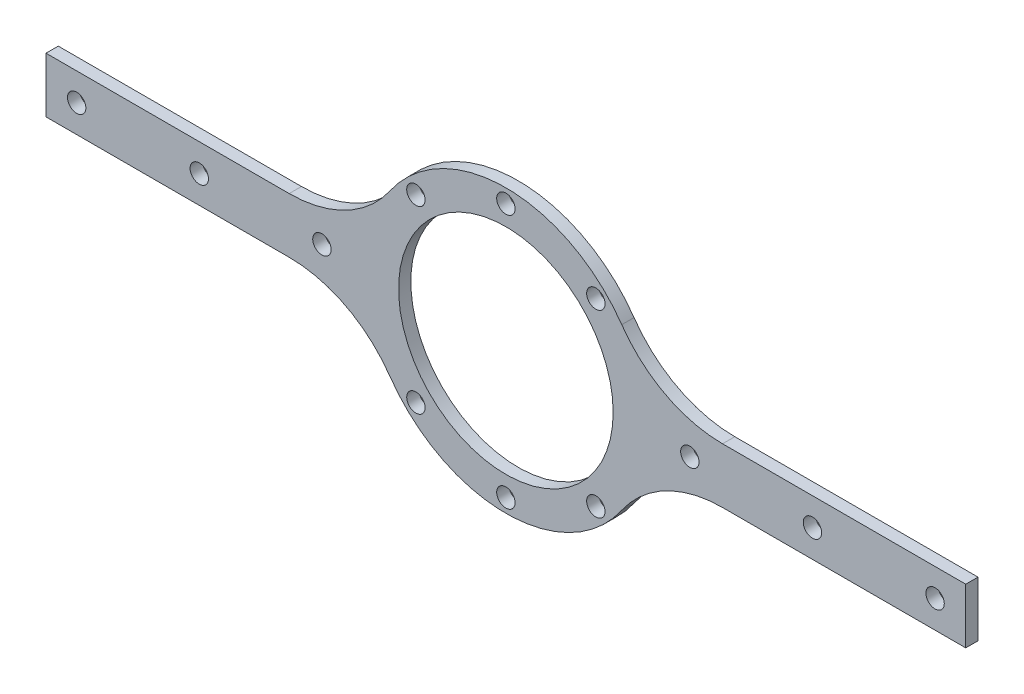
from build123d import *

# Parameters (mm, degrees)
SKETCH_1_R             = 1.5
SKETCH_1_R_2           = 17.5
SM_BASE_FLANGE_1_DEPTH = 2
FILLET_1_R             = 20


# Sheet-metal steps are written as plain solids
with BuildPart() as part:
    # Sketch 1 → 基体-法兰1 (new body)
    with BuildSketch(Plane.XY):
        with BuildLine():
            Line((22.555487137, 4.5), (75, 4.5))
            Line((75, 4.5), (75, -4.5))
            Line((75, -4.5), (22.555487137, -4.5))
            ThreePointArc((22.555487137, -4.5), (0, -23), (-22.555487137, -4.5))
            Line((-22.555487137, -4.5), (-75, -4.5))
            Line((-75, -4.5), (-75, 4.5))
            Line((-75, 4.5), (-22.555487137, 4.5))
            ThreePointArc((-22.555487137, 4.5), (0, 23), (22.555487137, 4.5))
        make_face()
        with Locations((0, 20.75)):
            Circle(SKETCH_1_R, mode=Mode.SUBTRACT)
        with Locations((14.67246571, 14.67246571)):
            Circle(SKETCH_1_R, mode=Mode.SUBTRACT)
        with Locations((14.67246571, -14.67246571)):
            Circle(SKETCH_1_R, mode=Mode.SUBTRACT)
        with Locations((0, -20.75)):
            Circle(SKETCH_1_R, mode=Mode.SUBTRACT)
        with Locations((-14.67246571, -14.67246571)):
            Circle(SKETCH_1_R, mode=Mode.SUBTRACT)
        with Locations((-14.67246571, 14.67246571)):
            Circle(SKETCH_1_R, mode=Mode.SUBTRACT)
        Circle(SKETCH_1_R_2, mode=Mode.SUBTRACT)
        with Locations((-70, 0)):
            Circle(SKETCH_1_R, mode=Mode.SUBTRACT)
        with Locations((-50, 0)):
            Circle(SKETCH_1_R, mode=Mode.SUBTRACT)
        with Locations((-30, 0)):
            Circle(SKETCH_1_R, mode=Mode.SUBTRACT)
        with Locations((30, 0)):
            Circle(SKETCH_1_R, mode=Mode.SUBTRACT)
        with Locations((50, 0)):
            Circle(SKETCH_1_R, mode=Mode.SUBTRACT)
        with Locations((70, 0)):
            Circle(SKETCH_1_R, mode=Mode.SUBTRACT)
    extrude(amount=-SM_BASE_FLANGE_1_DEPTH)

    # 圆角1
    fillet_1_edges = [part.edges().sort_by_distance(p)[0] for p in [
        (22.555487137, -4.5, -1),
        (-22.555487137, -4.5, -1),
        (-22.555487137, 4.5, -1),
        (22.555487137, 4.5, -1),
    ]]
    fillet(fillet_1_edges, radius=FILLET_1_R)


solid = part.part
